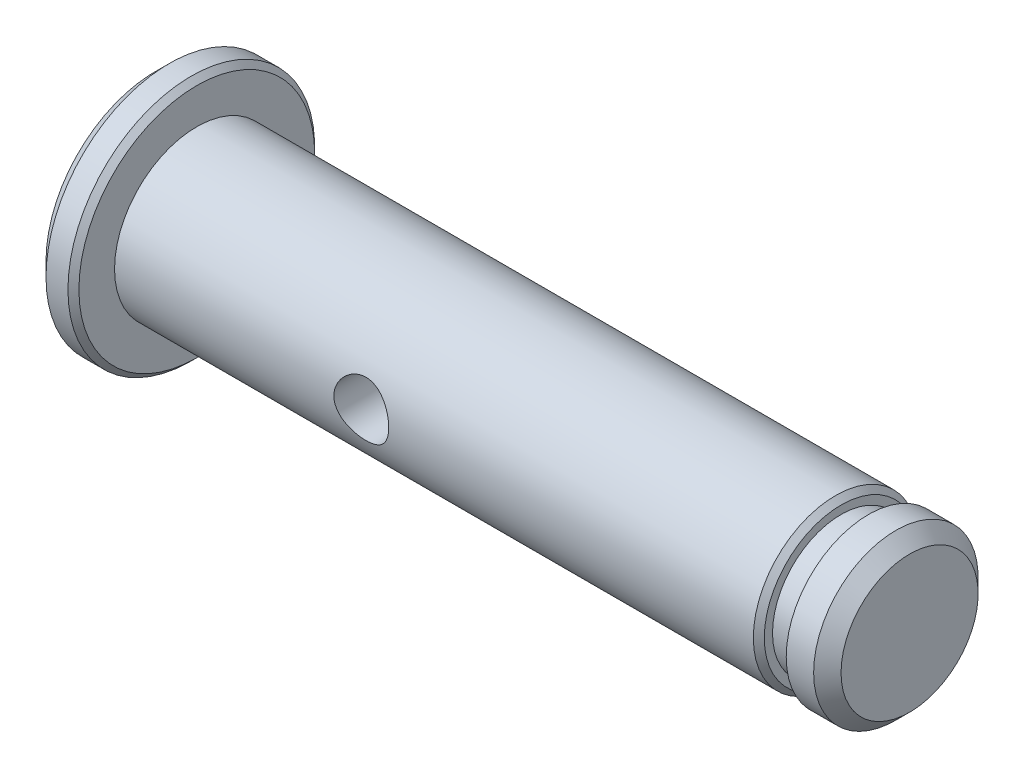
from build123d import *

# Parameters (mm, degrees)
CHAMFER_1_SIZE      = 0.5
SKETCH_2_R          = 1
CUT_EXTRUDE_1_DEPTH = 15
CHAMFER_2_SIZE      = 0.2


with BuildPart() as part:
    # 草图1 → 旋转1 (revolve)
    with BuildSketch(Plane.XY):
        Polygon((0, 0), (0, 4.5), (1.5, 4.5), (1.5, 3), (25, 3), (25, 2.5), (26, 2.5), (26, 3), (27.5, 3), (27.5, 0), align=None)
    revolve(axis=Axis((0, 0, 0), (1, 0, 0)))

    # 倒角1
    chamfer_1_edges = [part.edges().sort_by_distance(p)[0] for p in [
        (27.5, -3, 0),
        (0, -4.5, 0),
    ]]
    chamfer(chamfer_1_edges, length=CHAMFER_1_SIZE)

    # 草图2 → 切除-拉伸1 (cut, symmetric)
    with BuildSketch(Plane.XY):
        with Locations((10.5, 0)):
            Circle(SKETCH_2_R)
    extrude(amount=CUT_EXTRUDE_1_DEPTH, both=True, mode=Mode.SUBTRACT)

    # 倒角2
    chamfer_2_edges = [part.edges().sort_by_distance(p)[0] for p in [
        (25, -3, 0),
        (1.5, -4.5, 0),
    ]]
    chamfer(chamfer_2_edges, length=CHAMFER_2_SIZE)


solid = part.part
